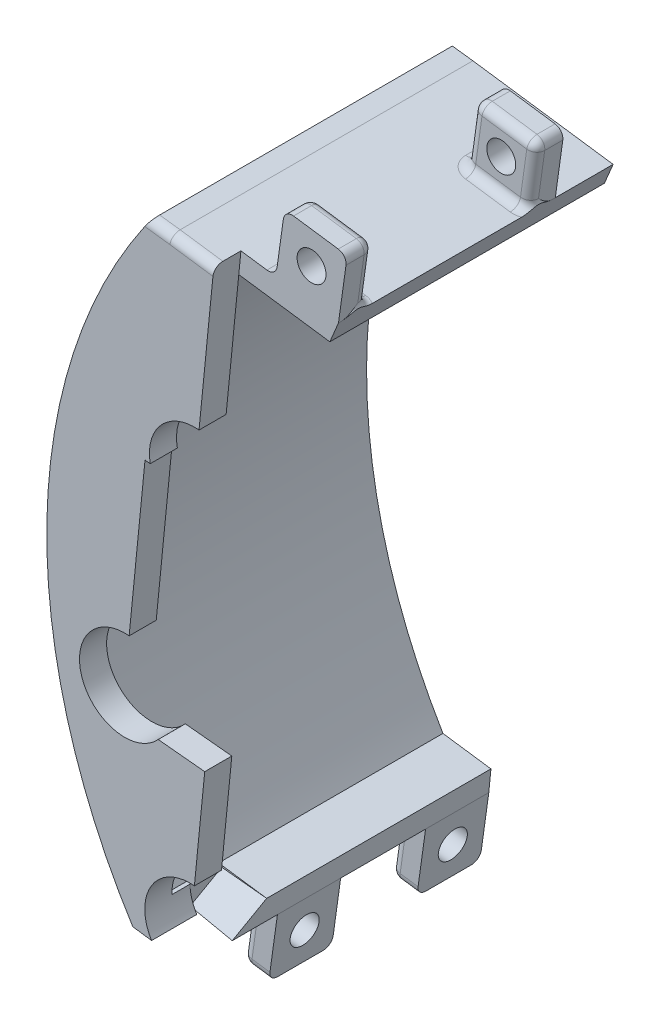
from build123d import *

# Parameters (mm, degrees)
SKETCH1_R              = 4.445
BOSS_EXTRUDE2_DEPTH    = 8.128
BOSS_EXTRUDE3_DEPTH    = 30.48
CUT_EXTRUDE1_START     = -38.608
CUT_EXTRUDE1_OUTLINE_R = 4.445
CUT_EXTRUDE1_DEPTH     = 38.608
BOSS_EXTRUDE13_DEPTH   = 3.81
BOSS_EXTRUDE14_DEPTH   = 8.128
SKETCH9_W              = 8.89
SKETCH9_H              = 3.81
BOSS_EXTRUDE15_DEPTH   = 8.89
SKETCH10_W             = 3.81
SKETCH10_H             = 8.89
BOSS_EXTRUDE16_DEPTH   = 8.89
SKETCH11_R             = 2.032
CUT_EXTRUDE3_DEPTH     = 453.756346398
SKETCH12_R             = 2.032
CUT_EXTRUDE4_DEPTH     = 167.419125065
FILLET1_R              = 1.27
FILLET2_R              = 1.27
FILLET3_R              = 1.27
SKETCH13_R             = 6.35
CUT_EXTRUDE5_DEPTH     = 6.35
SKETCH14_W             = 4.538183456
SKETCH14_H             = 0.271213631
CUT_EXTRUDE6_DEPTH     = 6.35


# Read off the part's stored shape, not the designer's step: Cut-Extrude1
with BuildPart() as part:
    # Sketch1 → Boss-Extrude2 (new body)
    with BuildSketch(Plane.XY):
        with BuildLine():
            Line((422.721831239, -137.260955008), (397.142573767, -117.628068619))
            Line((397.142573767, -117.628068619), (377.42339183, -114.876256201))
            Line((377.42339183, -114.876256201), (374.540581179, -114.51871973))
            ThreePointArc((374.540581179, -114.51871973), (359.974116362, -157.771470169), (372.030446696, -201.789957384))
            Line((372.030446696, -201.789957384), (375.362354889, -202.25020442))
            Line((375.362354889, -202.25020442), (407.292032563, -206.705991877))
            Line((407.292032563, -206.705991877), (428.301760664, -185.691281663))
            ThreePointArc((428.301760664, -185.691281663), (410.835199313, -163.167091308), (422.721831239, -137.260955008))
        make_face()
        with Locations((413.081283236, -189.895733265)):
            Circle(SKETCH1_R, mode=Mode.SUBTRACT)
        with BuildLine():
            Line((375.438501949, -117.676800355), (395.924761017, -120.535658409))
            Line((395.924761017, -120.535658409), (403.250926595, -126.158721416))
            Line((403.250926595, -126.158721416), (396.525446728, -140.500644454))
            ThreePointArc((396.525446728, -140.500644454), (394.840250533, -144.59682662), (393.557057048, -148.836167256))
            Line((393.557057048, -148.836167256), (408.135947471, -152.492527686))
            ThreePointArc((408.135947471, -152.492527686), (407.478732389, -164.116282679), (411.163311063, -175.160172021))
            Line((411.163311063, -175.160172021), (398.054918567, -182.514290852))
            ThreePointArc((398.054918567, -182.514290852), (404.027476783, -190.830097132), (411.692336104, -197.617881552))
            ThreePointArc((411.692336104, -197.617881552), (411.8058947, -197.693319009), (411.923337289, -197.76255486))
            Line((411.923337289, -197.76255486), (406.209814322, -203.477432695))
            Line((406.209814322, -203.477432695), (373.21862712, -198.873511552))
            ThreePointArc((373.21862712, -198.873511552), (362.510049562, -157.95204405), (375.438501949, -117.676800355))
        make_face(mode=Mode.SUBTRACT)
        with Locations((404.375009271, -140.520000011)):
            Circle(SKETCH1_R, mode=Mode.SUBTRACT)
    extrude(amount=BOSS_EXTRUDE2_DEPTH)


with BuildPart() as body_2:
    # Sketch2 → Boss-Extrude3 (new body)
    with BuildSketch(Plane.XY.offset(8.128)):
        with BuildLine():
            Line((397.142573767, -117.628068619), (377.42339183, -114.876256201))
            Line((377.42339183, -114.876256201), (374.540581179, -114.51871973))
            ThreePointArc((374.540581179, -114.51871973), (359.974116362, -157.771470169), (372.030446696, -201.789957384))
            Line((372.030446696, -201.789957384), (375.362354889, -202.25020442))
            Line((375.362354889, -202.25020442), (407.292032563, -206.705991877))
            Line((407.292032563, -206.705991877), (414.532433241, -199.463874257))
            ThreePointArc((414.532433241, -199.463874257), (409.852770309, -196.253623443), (405.604270928, -192.491282623))
            ThreePointArc((405.604270928, -192.491282623), (405.997230199, -190.639893213), (406.27151817, -188.767241124))
            ThreePointArc((406.27151817, -188.767241124), (395.867947628, -167.427396522), (398.397521154, -143.821793259))
            ThreePointArc((398.397521154, -143.821793259), (398.461114435, -137.105611235), (404.245702044, -133.692446827))
            ThreePointArc((404.245702044, -133.692446827), (407.006708255, -130.47787998), (410.071206758, -127.551201961))
            Line((410.071206758, -127.551201961), (397.142573767, -117.628068619))
        make_face()
        with BuildLine():
            ThreePointArc((403.061727172, -189.725585097), (401.059193553, -196.35778198), (397.415632908, -202.25020442))
            Line((397.415632908, -202.25020442), (373.21862712, -198.873511552))
            ThreePointArc((373.21862712, -198.873511552), (362.510049562, -157.95204405), (375.438501949, -117.676800355))
            Line((375.438501949, -117.676800355), (395.924761017, -120.535658409))
            Line((395.924761017, -120.535658409), (400.202083686, -123.818638382))
            ThreePointArc((400.202083686, -123.818638382), (401.150247915, -126.46196405), (401.831128402, -129.1864067))
            Line((401.831128402, -129.1864067), (400.808060919, -131.368073344))
            ThreePointArc((400.808060919, -131.368073344), (395.439235277, -136.441663908), (395.124115066, -143.821793259))
            ThreePointArc((395.124115066, -143.821793259), (392.848289911, -167.853501069), (403.061727172, -189.725585097))
        make_face(mode=Mode.SUBTRACT)
    extrude(amount=BOSS_EXTRUDE3_DEPTH)


with BuildPart() as cut_extrude1_tool:
    # Cut-Extrude1 outline → Cut-Extrude1 (new body)
    with BuildSketch(Plane.XY.offset(38.608).offset(CUT_EXTRUDE1_START)):
        with BuildLine():
            Line((397.142573767, -117.628068619), (395.924761017, -120.535658409))
            Line((395.924761017, -120.535658409), (400.202083686, -123.818638382))
            ThreePointArc((400.202083686, -123.818638382), (401.150247915, -126.46196405), (401.831128402, -129.1864067))
            Line((401.831128402, -129.1864067), (400.808060919, -131.368073344))
            ThreePointArc((400.808060919, -131.368073344), (395.439235277, -136.441663908), (395.124115066, -143.821793259))
            ThreePointArc((395.124115066, -143.821793259), (394.268902285, -146.306578133), (393.557057048, -148.836167256))
            ThreePointArc((393.557057048, -148.836167256), (392.580609278, -166.105992541), (398.054918568, -182.514290852))
            ThreePointArc((398.054918568, -182.514290852), (400.385798954, -186.239721497), (403.061727172, -189.725585097))
            ThreePointArc((403.061727172, -189.725585097), (401.059193553, -196.35778198), (397.415632908, -202.25020442))
            Line((397.415632908, -202.25020442), (379.967554953, -199.815324629))
            Line((379.967554953, -199.815324629), (379.666531571, -202.850852403))
            Line((379.666531571, -202.850852403), (407.292032563, -206.705991877))
            Line((407.292032563, -206.705991877), (428.301760664, -185.691281663))
            ThreePointArc((428.301760664, -185.691281663), (410.835199313, -163.167091308), (422.721831239, -137.260955008))
            Line((422.721831239, -137.260955008), (397.142573767, -117.628068619))
        make_face()
        with BuildLine():
            Line((411.923337289, -197.76255486), (411.913410508, -197.772483995))
            ThreePointArc((411.913410508, -197.772483995), (411.802759907, -197.695344929), (411.692336104, -197.617881552))
            ThreePointArc((411.692336104, -197.617881552), (411.8058947, -197.693319009), (411.923337289, -197.76255486))
        make_face(mode=Mode.SUBTRACT)
        with BuildLine():
            Line((411.163311063, -175.160172021), (400.71315601, -181.022956652))
            ThreePointArc((400.71315601, -181.022956652), (395.601784353, -165.702501323), (396.513495254, -149.57763683))
            Line((396.513495254, -149.57763683), (408.135947471, -152.492527686))
            ThreePointArc((408.135947471, -152.492527686), (407.478732389, -164.116282679), (411.163311063, -175.160172021))
        make_face(mode=Mode.SUBTRACT)
        with Locations((404.375009271, -140.520000011)):
            Circle(CUT_EXTRUDE1_OUTLINE_R, mode=Mode.SUBTRACT)
        with Locations((413.081283236, -189.895733265)):
            Circle(CUT_EXTRUDE1_OUTLINE_R, mode=Mode.SUBTRACT)
    extrude(amount=CUT_EXTRUDE1_DEPTH)


with BuildPart() as part_1:
    add(part.part)

    # Cut-Extrude1: cut by cut_extrude1_tool
    add(cut_extrude1_tool.part, mode=Mode.SUBTRACT)



with BuildPart() as body_2_1:
    add(body_2.part)

    # Cut-Extrude1: cut by cut_extrude1_tool
    add(cut_extrude1_tool.part, mode=Mode.SUBTRACT)

    # Sketch6 → Boss-Extrude13 (add)
    with BuildSketch(Plane.XY.offset(38.608)):
        with BuildLine():
            Line((377.42339183, -114.876256201), (374.540581179, -114.51871973))
            ThreePointArc((374.540581179, -114.51871973), (359.974116362, -157.771470169), (372.030446696, -201.789957384))
            Line((372.030446696, -201.789957384), (375.362354889, -202.25020442))
            Line((375.362354889, -202.25020442), (379.666531571, -202.850852403))
            Line((379.666531571, -202.850852403), (379.967554953, -199.815324629))
            Line((379.967554953, -199.815324629), (382.145421526, -177.853660286))
            Line((382.145421526, -177.853660286), (375.610038884, -177.20556772))
            ThreePointArc((375.610038884, -177.20556772), (364.972072555, -175.243382721), (371.521164554, -166.633743264))
            Line((371.521164554, -166.633743264), (373.754119512, -144.116566189))
            Line((373.754119512, -144.116566189), (374.487542914, -144.189297394))
            ThreePointArc((374.487542914, -144.189297394), (376.02820359, -138.703320505), (381.348097321, -136.661676945))
            Line((381.348097321, -136.661676945), (383.425425917, -115.713840234))
            Line((383.425425917, -115.713840234), (377.42339183, -114.876256201))
        make_face()
    extrude(amount=BOSS_EXTRUDE13_DEPTH)


with BuildPart() as part_2:
    add(part_1.part)

    add(body_2_1.part)  # Boss-Extrude14 merges body 2
    # Sketch7 → Boss-Extrude14 (add)
    with BuildSketch(Plane(origin=(0, 0, 8.128), x_dir=(-1, 0, 0), z_dir=(0, 0, -1))):
        with BuildLine():
            Line((-380.886266304, -115.359500436), (-383.425425917, -115.713840234))
            Line((-383.425425917, -115.713840234), (-383.124402536, -118.749368007))
            Line((-383.124402536, -118.749368007), (-378.816626061, -118.148217674))
            ThreePointArc((-378.816626061, -118.148217674), (-379.834773745, -116.741485643), (-380.886266304, -115.359500436))
        make_face()
    extrude(amount=BOSS_EXTRUDE14_DEPTH)

    # Sketch9 → Boss-Extrude15 (add)
    with BuildSketch(Plane(origin=(-8.515136706, -61.018523217, 0), x_dir=(0.9904028421684975, -0.13821074569136185, 0), z_dir=(0.13821074569136185, 0.9904028421684975, 0))):
        with Locations((405.143596883, -10.033)):
            Rectangle(SKETCH9_W, SKETCH9_H)
        with Locations((405.143596883, -36.703)):
            Rectangle(SKETCH9_W, SKETCH9_H)
    extrude(amount=BOSS_EXTRUDE15_DEPTH)

    # Sketch10 → Boss-Extrude16 (add)
    with BuildSketch(Plane(origin=(-20.514630148, -147.00555954, 0), x_dir=(0.9904028421684976, -0.1382107456913612, 0), z_dir=(-0.1382107456913612, -0.9904028421684976, 0))):
        with Locations((402.153979519, 25.273)):
            Rectangle(SKETCH10_W, SKETCH10_H)
        with Locations((402.153979519, 4.445)):
            Rectangle(SKETCH10_W, SKETCH10_H)
    extrude(amount=BOSS_EXTRUDE16_DEPTH)

    # Sketch11 → Cut-Extrude3 (cut, through all)
    with BuildSketch(Plane.XY.offset(38.608)):
        with Locations((393.354579898, -112.611381221)):
            Circle(SKETCH11_R)
    extrude(amount=-CUT_EXTRUDE3_DEPTH, mode=Mode.SUBTRACT)

    # Sketch12 → Cut-Extrude4 (cut, through all)
    with BuildSketch(Plane(origin=(400.181161719, -55.845292863, 0), x_dir=(0, 0, -1), z_dir=(0.9904028421684976, -0.13821074569136127, 0))):
        with Locations(Location((-25.273, -152.875066313, 0), (0, 0, 90))):
            Circle(SKETCH12_R)
        with Locations(Location((-4.445, -152.875066313, 0), (0, 0, 90))):
            Circle(SKETCH12_R)
    extrude(amount=-CUT_EXTRUDE4_DEPTH, mode=Mode.SUBTRACT)

    # Fillet1
    fillet1_edges = [part_2.edges().sort_by_distance(p)[0] for p in [
        (374.664403213, -211.128950728, 4.445),
        (375.278749978, -206.726610095, 8.89),
        (375.278749978, -206.726610095, 0),
        (376.551120627, -211.392242199, 0),
        (376.551120627, -211.392242199, 8.89),
        (375.278749978, -206.726610095, 20.828),
        (376.551120627, -211.392242199, 20.828),
        (376.551120627, -211.392242199, 29.718),
        (380.424408874, -115.295048218, 42.418),
        (388.952239264, -111.997034457, 34.798),
        (397.756920531, -113.225727986, 34.798),
        (393.968926662, -108.209040588, 34.798),
        (389.566586029, -107.594693823, 36.703),
        (398.371267296, -108.823387352, 36.703),
        (388.952239264, -111.997034457, 11.938),
        (389.566586029, -107.594693823, 10.033),
        (398.371267296, -108.823387352, 10.033),
        (393.968926662, -108.209040588, 11.938),
        (397.756920531, -113.225727986, 11.938),
        (375.981986505, -114.697487965, 42.418),
    ]]
    fillet(fillet1_edges, radius=FILLET1_R)

    # Fillet2
    # the kernel refuses this fillet: 1.27 mm, written as the material it adds along each edge
    with BuildSketch(Plane(origin=(388.3378925, -116.39937509, 10.668), x_dir=(-0.9904028421685107, 0.13821074569126718, 0), z_dir=(0, 0, -1))) as fillet2_piece_1:
        with BuildLine():
            CenterArc((FILLET2_R, FILLET2_R), FILLET2_R, 180, 90)
            Line((0, FILLET2_R), (0, 0))
            Line((0, 0), (FILLET2_R, 0))
        make_face()
    extrude(amount=2.54)
    with BuildSketch(Plane(origin=(388.3378925, -116.39937509, 38.608), x_dir=(0.1382107456913754, 0.9904028421684955, 0), z_dir=(0, 0, -1))) as fillet2_piece_2:
        with BuildLine():
            CenterArc((FILLET2_R, -FILLET2_R), FILLET2_R, 90, 90)
            Line((0, -FILLET2_R), (0, 0))
            Line((0, 0), (FILLET2_R, 0))
        make_face()
    extrude(amount=2.54)
    with BuildSketch(Plane(origin=(389.595704109, -116.574902737, 34.798), x_dir=(0.13821074569136188, 0.9904028421684975, 0), z_dir=(0.9904028421684975, -0.13821074569136185, 0))) as fillet2_piece_3:
        with BuildLine():
            CenterArc((FILLET2_R, -FILLET2_R), FILLET2_R, 90, 90)
            Line((0, -FILLET2_R), (0, 0))
            Line((0, 0), (FILLET2_R, 0))
        make_face()
    extrude(amount=6.35)
    with BuildSketch(Plane(origin=(395.884762157, -117.452540972, 11.938), x_dir=(0, 0, 1), z_dir=(-0.9904028421684975, 0.13821074569136185, 0))) as fillet2_piece_4:
        with BuildLine():
            CenterArc((FILLET2_R, FILLET2_R), FILLET2_R, 180, 90)
            Line((0, FILLET2_R), (0, 0))
            Line((0, 0), (FILLET2_R, 0))
        make_face()
    extrude(amount=6.35)
    with BuildSketch(Plane(origin=(389.595704109, -116.574902737, 36.068), x_dir=(-0.9904028421684968, 0.13821074569136593, 0), z_dir=(0, 0, 1))) as fillet2_piece_5:
        with BuildLine():
            CenterArc((1.27 + FILLET2_R, -FILLET2_R), FILLET2_R, 90, 90)
            Line((1.27 + FILLET2_R, 0), (1.27, 0))
            Line((1.27, 0), (1.27, -FILLET2_R))
        make_face()
    revolve(axis=Axis((389.595704109, -116.574902737, 36.068), (-0.13821074569136185, -0.9904028421684976, 0)), revolution_arc=90)
    with BuildSketch(Plane(origin=(395.884762157, -117.452540972, 36.068), x_dir=(-0.794049773292646, 0.11080966916708142, 0.5976672776327808), z_dir=(-0.5919313704386147, 0.08260404011695283, -0.8017442392976832))) as fillet2_piece_6_section:
        with BuildLine():
            CenterArc((1.27 + FILLET2_R, FILLET2_R), FILLET2_R, 180, 90)
            Line((1.27 + FILLET2_R, 0), (1.27, 0))
            Line((1.27, 0), (1.27, FILLET2_R))
        make_face()
    fillet2_piece_6 = revolve(axis=Axis((395.884762157, -117.452540972, 36.068), (0.13821074569136185, 0.9904028421684976, 0)), revolution_arc=233.296989237, mode=Mode.PRIVATE)
    fillet2_piece_6 = split(fillet2_piece_6, bisect_by=Plane(origin=(397.316474469, -117.212871861, 36.083951798), z_dir=(-0.9223638930566347, 0.3863222085065898, 0)), keep=Keep.TOP, mode=Mode.PRIVATE)
    add(fillet2_piece_6)
    with BuildSketch(Plane(origin=(389.595704109, -116.574902737, 10.668), x_dir=(0, 0, 1), z_dir=(0.9904028421684976, -0.13821074569136185, 0))) as fillet2_piece_7:
        with BuildLine():
            CenterArc((1.27 + FILLET2_R, -FILLET2_R), FILLET2_R, 90, 90)
            Line((1.27, -FILLET2_R), (1.27, 0))
            Line((1.27, 0), (1.27 + FILLET2_R, 0))
        make_face()
    revolve(axis=Axis((389.595704109, -116.574902737, 10.668), (-0.13821074569136185, -0.9904028421684976, 0)), revolution_arc=90)
    with BuildSketch(Plane(origin=(395.884762157, -117.452540972, 10.668), x_dir=(-0.7940497732926503, 0.11080966916709321, -0.5976672776327729), z_dir=(-0.5919313704386069, 0.08260404011695174, 0.8017442392976891))) as fillet2_piece_8_section:
        with BuildLine():
            CenterArc((1.27 + FILLET2_R, -FILLET2_R), FILLET2_R, 90, 90)
            Line((1.27, -FILLET2_R), (1.27, 0))
            Line((1.27, 0), (1.27 + FILLET2_R, 0))
        make_face()
    fillet2_piece_8 = revolve(axis=Axis((395.884762157, -117.452540972, 10.668), (-0.13821074569136185, -0.9904028421684976, 0)), revolution_arc=233.296989237, mode=Mode.PRIVATE)
    fillet2_piece_8 = split(fillet2_piece_8, bisect_by=Plane(origin=(397.316474655, -117.212871416, 10.652053572), z_dir=(-0.9223638930566347, 0.3863222085065898, 0)), keep=Keep.TOP, mode=Mode.PRIVATE)
    add(fillet2_piece_8)

    # Fillet3
    # the kernel refuses this fillet: 1.27 mm, written as the material it takes off along each edge
    with BuildSketch(Plane(origin=(376.09774247, -210.046666766, 22.098), x_dir=(-0.1382107456913612, -0.9904028421684976, 0), z_dir=(-0.9904028421684976, 0.1382107456913612, 0))) as fillet3_piece_1_section:
        Polygon((0, 0), (FILLET3_R, 0), (FILLET3_R, -FILLET3_R), (0, -FILLET3_R), align=None)
    fillet3_piece_1 = extrude(amount=FILLET3_R, mode=Mode.PRIVATE)
    fillet3_piece_1 = fillet3_piece_1 - Plane(origin=(376.09774247, -210.046666766, 22.098), x_dir=(0.0977297555112109, 0.7003205658037746, 0.7071067811865475), z_dir=(-0.9904028421684976, 0.1382107456913612, 0)) * Sphere(FILLET3_R, mode=Mode.PRIVATE)
    add(fillet3_piece_1, mode=Mode.SUBTRACT)
    with BuildSketch(Plane(origin=(374.664403213, -211.128950728, 28.448), x_dir=(0.13821074569137695, 0.9904028421684954, 0), z_dir=(0, 0, -1))) as fillet3_piece_2:
        with BuildLine():
            CenterArc((FILLET3_R, FILLET3_R), FILLET3_R, 180, 90)
            Line((0, FILLET3_R), (0, 0))
            Line((0, 0), (FILLET3_R, 0))
        make_face()
    extrude(amount=6.35, mode=Mode.SUBTRACT)
    with BuildSketch(Plane(origin=(375.893096742, -202.324269462, 29.718), x_dir=(0, 0, -1), z_dir=(-0.1382107456913612, -0.9904028421684976, 0))) as fillet3_piece_3:
        with BuildLine():
            CenterArc((FILLET3_R, FILLET3_R), FILLET3_R, 180, 90)
            Line((0, FILLET3_R), (0, 0))
            Line((0, 0), (FILLET3_R, 0))
        make_face()
    extrude(amount=7.62, mode=Mode.SUBTRACT)
    with BuildSketch(Plane(origin=(374.83993086, -209.871139119, 28.448), x_dir=(0, 0, 1), z_dir=(0.1382107456913612, 0.9904028421684976, 0))) as fillet3_piece_4:
        with BuildLine():
            CenterArc((1.27 - FILLET3_R, FILLET3_R), FILLET3_R, 270, 90)
            Line((1.27, FILLET3_R), (1.27, 0))
            Line((1.27, 0), (1.27 - FILLET3_R, 0))
        make_face()
    revolve(axis=Axis((374.83993086, -209.871139119, 28.448), (0.9904028421684976, -0.1382107456913612, 0)), revolution_arc=90, mode=Mode.SUBTRACT)

    # Sketch13 → Cut-Extrude5 (cut)
    with BuildSketch(Plane.XY.offset(42.418)):
        with Locations((380.067816669, -198.804282819)):
            Circle(SKETCH13_R)
    extrude(amount=-CUT_EXTRUDE5_DEPTH, mode=Mode.SUBTRACT)

    # Sketch14 → Cut-Extrude6 (cut)
    with BuildSketch(Plane(origin=(395.889395758, -39.259059252, 0), x_dir=(0, 0, -1), z_dir=(0.9951189501977515, -0.0986826983686861, 0))):
        with Locations((-33.798908272, -161.208185649)):
            Rectangle(SKETCH14_W, SKETCH14_H)
        Polygon((-36.068, -161.343792464), (-36.068, -164.394209474), (-31.529816544, -161.343792464), align=None)
    extrude(amount=-CUT_EXTRUDE6_DEPTH, mode=Mode.SUBTRACT)


solid = part_2.part
